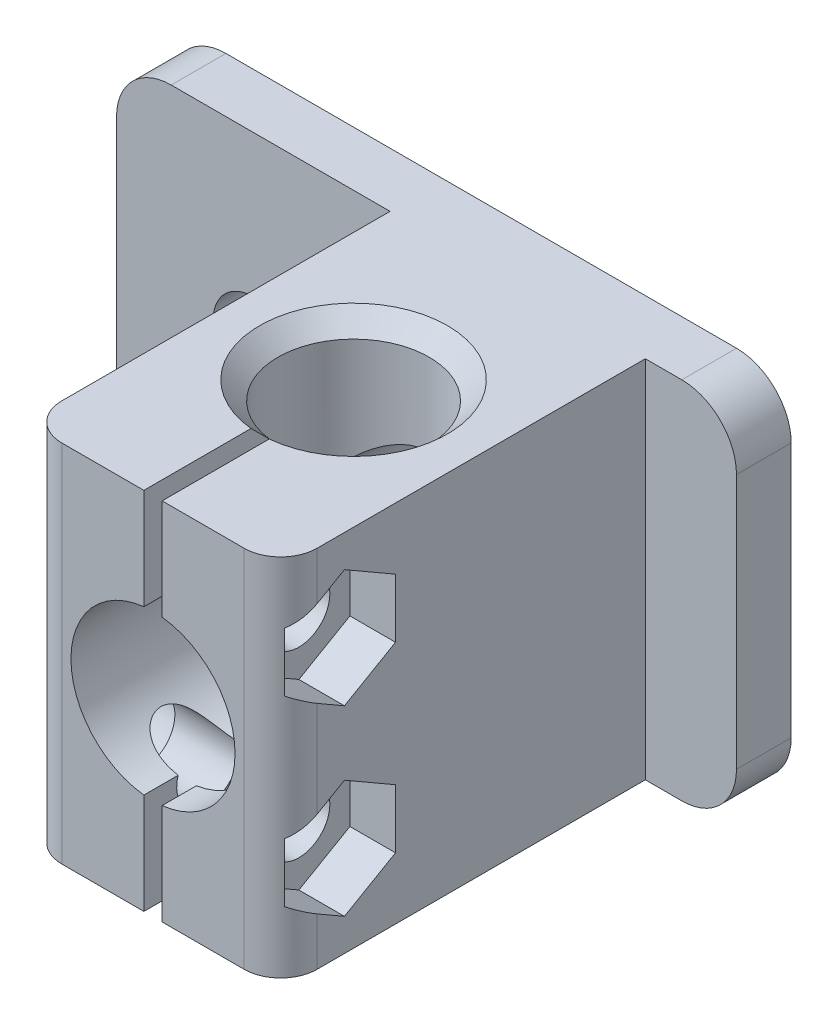
from build123d import *

# Parameters (mm, degrees)
SKETCH1_W           = 34
SKETCH1_H           = 20
BOSS_EXTRUDE1_DEPTH = 3
FILLET1_R           = 3
SKETCH2_W           = 14
SKETCH2_H           = 20
BOSS_EXTRUDE2_DEPTH = 20
CUT_EXTRUDE1_DEPTH  = 35.899856733
CHAMFER1_SIZE       = 1
SKETCH4_R           = 2.2
CUT_EXTRUDE2_DEPTH  = 29.08914381
SKETCH5_R           = 1.7
CUT_EXTRUDE3_DEPTH  = 39.340579025
FILLET2_R           = 2
CUT_EXTRUDE4_DEPTH  = 2.5
SKETCH7_R           = 2.75
CUT_EXTRUDE5_DEPTH  = 3
SKETCH8_R           = 2.2
CUT_EXTRUDE6_DEPTH  = 31.298514848
SKETCH9_R           = 4.5
CUT_EXTRUDE7_DEPTH  = 21


with BuildPart() as part:
    # Sketch1 → Boss-Extrude1 (new body)
    with BuildSketch(Plane.XY):
        Rectangle(SKETCH1_W, SKETCH1_H)
    extrude(amount=BOSS_EXTRUDE1_DEPTH)

    # Fillet1
    fillet1_edges = [part.edges().sort_by_distance(p)[0] for p in [
        (17, -10, 1.5),
        (-17, -10, 1.5),
        (-17, 10, 1.5),
        (17, 10, 1.5),
    ]]
    fillet(fillet1_edges, radius=FILLET1_R)

    # Sketch2 → Boss-Extrude2 (add)
    with BuildSketch(Plane.XY.offset(3)):
        with Locations((5, 0)):
            Rectangle(SKETCH2_W, SKETCH2_H)
    extrude(amount=BOSS_EXTRUDE2_DEPTH)

    # Sketch3 → Cut-Extrude1 (cut, through all)
    with BuildSketch(Plane(origin=(0, 10, 0), x_dir=(1, 0, 0), z_dir=(0, 1, 0))):
        with BuildLine():
            Line((4.5, -16.119769411), (4.5, -23))
            Line((4.5, -23), (5.5, -23))
            Line((5.5, -23), (5.5, -16.119769411))
            ThreePointArc((5.5, -16.119769411), (5, -7.85), (4.5, -16.119769411))
        make_face()
    extrude(amount=-CUT_EXTRUDE1_DEPTH, mode=Mode.SUBTRACT)

    # Chamfer1
    chamfer1_edges = [part.edges().sort_by_distance(p)[0] for p in [
        (5, -10, 7.85),
        (5, 10, 7.85),
    ]]
    chamfer(chamfer1_edges, length=CHAMFER1_SIZE)

    # Sketch4 → Cut-Extrude2 (cut, through all)
    with BuildSketch(Plane.XY.offset(3)):
        with Locations((-9.5, 0)):
            Circle(SKETCH4_R)
    extrude(amount=-CUT_EXTRUDE2_DEPTH, mode=Mode.SUBTRACT)

    # Sketch5 → Cut-Extrude3 (cut, through all)
    with BuildSketch(Plane(origin=(12, 0, 0), x_dir=(0, 0, -1), z_dir=(1, 0, 0))):
        with Locations(Location((-19.5, 5, 0), (0, 0, 90))):
            Circle(SKETCH5_R)
        with Locations(Location((-19.5, -5, 0), (0, 0, 90))):
            Circle(SKETCH5_R)
    extrude(amount=-CUT_EXTRUDE3_DEPTH, mode=Mode.SUBTRACT)

    # Fillet2
    # the kernel refuses this fillet: 2 mm, written as the material it takes off along each edge
    with BuildSketch(Plane(origin=(12, -15, 23), x_dir=(-1, 0, 0), z_dir=(0, 1, 0)), Plane(origin=(-2, 15, 23), x_dir=(1, 0, 0), z_dir=(0, -1, 0))) as fillet2_piece_1:
        with BuildLine():
            CenterArc((FILLET2_R, -FILLET2_R), FILLET2_R, 90, 90)
            Line((0, -FILLET2_R), (0, 0))
            Line((0, 0), (FILLET2_R, 0))
        make_face()
    extrude(amount=30, mode=Mode.SUBTRACT)

    # Sketch6 → Cut-Extrude4 (cut)
    with BuildSketch(Plane(origin=(12, 0, 0), x_dir=(0, 0, -1), z_dir=(1, 0, 0))):
        Polygon((-16.7, 3.383419246), (-16.7, 6.616580754), (-19.5, 8.233161507), (-22.3, 6.616580754), (-22.3, 3.383419246), (-19.5, 1.766838493), align=None)
        Polygon((-16.7, -3.383419246), (-19.5, -1.766838493), (-22.3, -3.383419246), (-22.3, -6.616580754), (-19.5, -8.233161507), (-16.7, -6.616580754), align=None)
    extrude(amount=-CUT_EXTRUDE4_DEPTH, mode=Mode.SUBTRACT)

    # Sketch7 → Cut-Extrude5 (cut)
    with BuildSketch(Plane.ZY.offset(2)):
        with Locations(Location((19.5, 5, 0), (0, 0, 270))):
            Circle(SKETCH7_R)
        with Locations(Location((19.5, -5, 0), (0, 0, 270))):
            Circle(SKETCH7_R)
    extrude(amount=-CUT_EXTRUDE5_DEPTH, mode=Mode.SUBTRACT)

    # Sketch8 → Cut-Extrude6 (cut, through all)
    with BuildSketch(Plane.XY.offset(23)):
        with Locations((5, 0)):
            Circle(SKETCH8_R)
    extrude(amount=-CUT_EXTRUDE6_DEPTH, mode=Mode.SUBTRACT)

    # Sketch9 → Cut-Extrude7 (cut)
    with BuildSketch(Plane.XY.offset(23)):
        with Locations((5, 0)):
            Circle(SKETCH9_R)
    extrude(amount=-CUT_EXTRUDE7_DEPTH, mode=Mode.SUBTRACT)


solid = part.part
